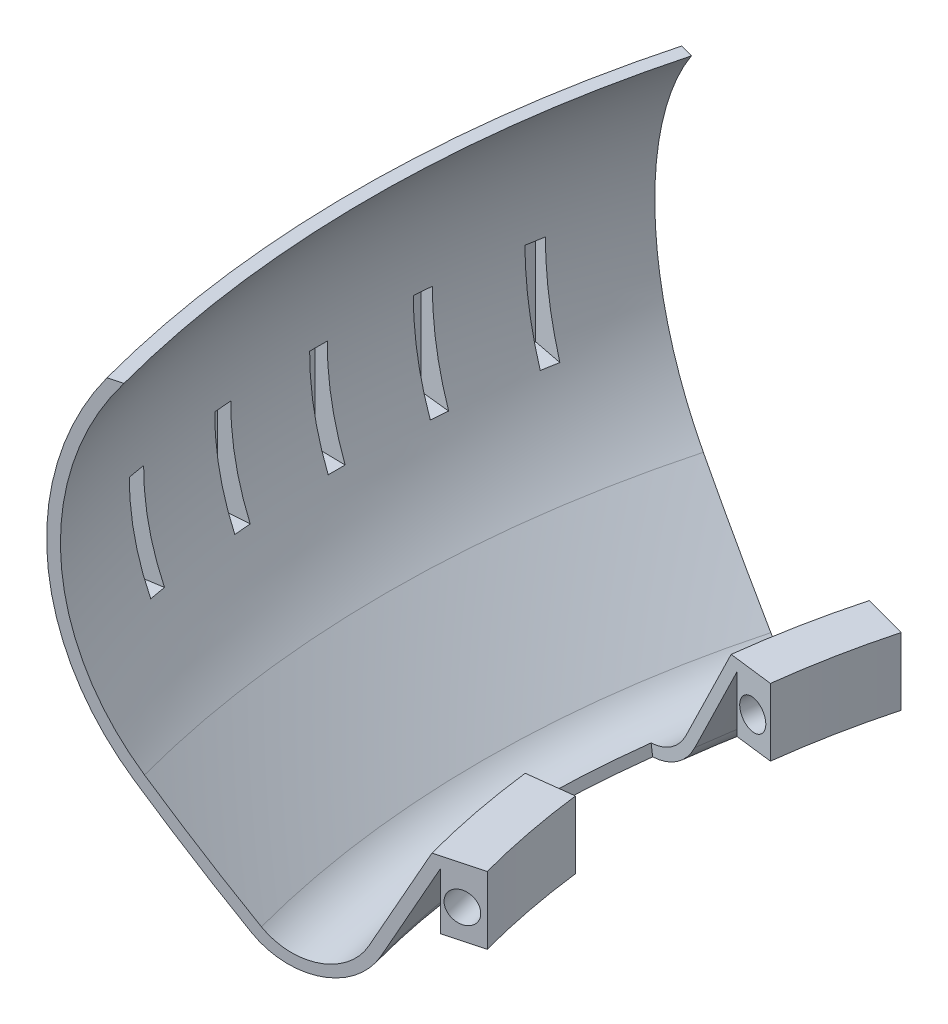
from build123d import *

# Parameters (mm, degrees)
REVOLVE1_ANGLE                  = 15
REVOLVE1_OTHER_WAY_ANGLE        = 15
REVOLVE2_START                  = 16.222144695
REVOLVE2_DEPTH                  = 16.090427574
CIRPATTERN1_COUNT               = 3
CIRPATTERN1_ANGLE               = 10
CIRPATTERN1_THE_OTHER_WAY_COUNT = 3
CIRPATTERN1_THE_OTHER_WAY_ANGLE = 10
SHELL3_START                    = 8.985762726
SHELL3_2_DEPTH                  = 42.380509533
SHELL3_START_2                  = 17.722144695
SHELL3_3_DEPTH                  = 13.090427574
SKETCH3_W                       = 5.112055803
SKETCH3_H                       = 7.485762726
REVOLVE3_ANGLE                  = 15
REVOLVE3_OTHER_WAY_ANGLE        = 15
CUT_REVOLVE2_ANGLE              = 7
CUT_REVOLVE2_OTHER_WAY_ANGLE    = 7
SKETCH11_R                      = 2


with BuildPart() as part:
    # Sketch1 → Revolve1 (revolve)
    with BuildSketch(Plane.XY):
        with BuildLine():
            Line((-111.783895357, 7.485762726), (-118.250728673, -4.885300025))
            ThreePointArc((-118.250728673, -4.885300025), (-124.705004152, -9.547595462), (-132.307869355, -7.183042355))
            ThreePointArc((-132.307869355, -7.183042355), (-138.813052314, -0.732302942), (-145.106903203, 5.924789912))
            ThreePointArc((-145.106903203, 5.924789912), (-154.580954265, 28.121202409), (-148.092110072, 51.366272259))
            Line((-148.092110072, 51.366272259), (-106.671839554, 51.366272259))
            Line((-106.671839554, 51.366272259), (-106.671839554, 7.485762726))
            Line((-106.671839554, 7.485762726), (-111.783895357, 7.485762726))
        make_face()
    revolve(axis=Axis((0, 75.962527062, 0), (0, -1, 0)), revolution_arc=REVOLVE1_ANGLE)

    # Sketch1 → Revolve1 other way (revolve)
    with BuildSketch(Plane.XY):
        with BuildLine():
            Line((-111.783895357, 7.485762726), (-118.250728673, -4.885300025))
            ThreePointArc((-118.250728673, -4.885300025), (-124.705004152, -9.547595462), (-132.307869355, -7.183042355))
            ThreePointArc((-132.307869355, -7.183042355), (-138.813052314, -0.732302942), (-145.106903203, 5.924789912))
            ThreePointArc((-145.106903203, 5.924789912), (-154.580954265, 28.121202409), (-148.092110072, 51.366272259))
            Line((-148.092110072, 51.366272259), (-106.671839554, 51.366272259))
            Line((-106.671839554, 51.366272259), (-106.671839554, 7.485762726))
            Line((-106.671839554, 7.485762726), (-111.783895357, 7.485762726))
        make_face()
    revolve(axis=Axis((0, 75.962527062, 0), (0, 1, 0)), revolution_arc=REVOLVE1_OTHER_WAY_ANGLE)

    # Revolve2: read off the stored shape, not the designer's step
    # Revolve2 outline → Revolve2 (add)
    with BuildSketch(Plane(origin=(0, 0, 0), x_dir=(1, 0, 0), z_dir=(0, 1, 0)).offset(REVOLVE2_START)):
        with BuildLine():
            ThreePointArc((-156.32174005, 2.728606122), (-156.345552235, 0), (-156.32174005, -2.728606122))
            Line((-156.32174005, -2.728606122), (-151.716418742, -2.64821994))
            Line((-151.716418742, -2.64821994), (-150, -2.61825974))
            Line((-150, -2.61825974), (-150, 2.61825974))
            Line((-150, 2.61825974), (-151.716418742, 2.64821994))
            Line((-151.716418742, 2.64821994), (-156.32174005, 2.728606122))
        make_face()
    revolve2 = extrude(amount=REVOLVE2_DEPTH)

    # CirPattern1: Revolve2 ×3 about axis
    cirpattern1_axis = Axis((0, 0, 0), (0, 1, 0))
    for i in range(1, CIRPATTERN1_COUNT):
        add(revolve2.rotate(cirpattern1_axis, i * CIRPATTERN1_ANGLE / (CIRPATTERN1_COUNT - 1)))

    # CirPattern1 the other way: Revolve2 ×3 about axis
    cirpattern1_the_other_way_axis = Axis((0, 0, 0), (0, -1, 0))
    for i in range(1, CIRPATTERN1_THE_OTHER_WAY_COUNT):
        add(revolve2.rotate(cirpattern1_the_other_way_axis, i * CIRPATTERN1_THE_OTHER_WAY_ANGLE / (CIRPATTERN1_THE_OTHER_WAY_COUNT - 1)))

    # Shell3: read off the stored shape, not the designer's step
    # Shell3 outline → Shell3 (revolve, cut)
    with BuildSketch(Plane.XY):
        with BuildLine():
            ThreePointArc((131.268982929, -6.101046516), (137.739825777, 0.315640187), (144.000452154, 6.937591016))
            ThreePointArc((144.000452154, 6.937591016), (153.114903986, 28.748570347), (146.242378119, 51.366272259))
            Line((146.242378119, 51.366272259), (112.692366824, 51.366272259))
            Line((112.692366824, 51.366272259), (112.692366824, 8.985762726))
            Line((112.692366824, 8.985762726), (119.5800606, -4.190406776))
            ThreePointArc((119.5800606, -4.190406776), (124.946978842, -8.067241366), (131.268982929, -6.101046516))
        make_face()
    revolve(axis=Axis((0, 0, 0), (0, 1, 0)), mode=Mode.SUBTRACT)

    # Shell3 2 outline → Shell3 2 (cut)
    with BuildSketch(Plane(origin=(0, 0, 0), x_dir=(1, 0, 0), z_dir=(0, 1, 0)).offset(SHELL3_START)):
        with BuildLine():
            Line((-103.037084763, 27.608703653), (-108.852467541, 29.166930772))
            ThreePointArc((-108.852467541, 29.166930772), (-112.692366824, 0), (-108.852467541, -29.166930772))
            Line((-108.852467541, -29.166930772), (-103.037084763, -27.608703653))
            ThreePointArc((-103.037084763, -27.608703653), (-106.671839554, 0), (-103.037084763, 27.608703653))
        make_face()
    extrude(amount=SHELL3_2_DEPTH, mode=Mode.SUBTRACT)

    # Shell3 3 outline → Shell3 3 (cut)
    with BuildSketch(Plane(origin=(0, 0, 0), x_dir=(1, 0, 0), z_dir=(0, 1, 0)).offset(SHELL3_START_2)):
        with BuildLine():
            ThreePointArc((-154.840882749, 1.20252917), (-154.845552235, 0), (-154.840882749, -1.20252917))
            Line((-154.840882749, -1.20252917), (-150.729272176, -1.13076074))
            Line((-150.729272176, -1.13076074), (-112.691399989, -0.466807206))
            ThreePointArc((-112.691399989, -0.466807206), (-112.692366824, 0), (-112.691399989, 0.466807206))
            Line((-112.691399989, 0.466807206), (-150.729272176, 1.13076074))
            Line((-150.729272176, 1.13076074), (-154.840882749, 1.20252917))
        make_face()
        with BuildLine():
            ThreePointArc((-112.22189026, -10.286733541), (-112.263538345, -9.821786937), (-112.303260118, -9.356671802))
            Line((-112.303260118, -9.356671802), (-150.254254081, -12.010463816))
            Line((-150.254254081, -12.010463816), (-154.356473766, -12.29731896))
            ThreePointArc((-154.356473766, -12.29731896), (-154.25631816, -13.495679116), (-154.14685912, -14.693225327))
            Line((-154.14685912, -14.693225327), (-150.057149497, -14.263379525))
            Line((-150.057149497, -14.263379525), (-112.22189026, -10.286733541))
        make_face()
        with BuildLine():
            Line((-150.254254081, 12.010463816), (-112.303260118, 9.356671802))
            ThreePointArc((-112.303260118, 9.356671802), (-112.263538345, 9.821786937), (-112.22189026, 10.286733541))
            Line((-112.22189026, 10.286733541), (-150.057149497, 14.263379525))
            Line((-150.057149497, 14.263379525), (-154.14685912, 14.693225327))
            ThreePointArc((-154.14685912, 14.693225327), (-154.25631816, 13.495679116), (-154.356473766, 12.29731896))
            Line((-154.356473766, 12.29731896), (-150.254254081, 12.010463816))
        make_face()
        with BuildLine():
            ThreePointArc((-110.898304185, -20.028371609), (-110.980316554, -19.568824134), (-111.060424629, -19.108940881))
            Line((-111.060424629, -19.108940881), (-148.635710387, -25.06028149))
            Line((-148.635710387, -25.06028149), (-152.697318814, -25.703577068))
            ThreePointArc((-152.697318814, -25.703577068), (-152.493100361, -26.888647965), (-152.279684816, -28.072097167))
            Line((-152.279684816, -28.072097167), (-110.898304185, -20.028371609))
        make_face()
        with BuildLine():
            Line((-148.635710387, 25.06028149), (-111.060424629, 19.108940881))
            ThreePointArc((-111.060424629, 19.108940881), (-110.980316554, 19.568824134), (-110.898304185, 20.028371609))
            Line((-110.898304185, 20.028371609), (-152.279684816, 28.072097167))
            ThreePointArc((-152.279684816, 28.072097167), (-152.493100361, 26.888647965), (-152.697318814, 25.703577068))
            Line((-152.697318814, 25.703577068), (-148.635710387, 25.06028149))
        make_face()
    extrude(amount=SHELL3_3_DEPTH, mode=Mode.SUBTRACT)

    # Sketch3 → Revolve3 (revolve)
    with BuildSketch(Plane.XY):
        with Locations((-109.227867456, 3.742881363)):
            Rectangle(SKETCH3_W, SKETCH3_H)
    revolve(axis=Axis((0, 7.485762726, 0), (0, 1, 0)), revolution_arc=REVOLVE3_ANGLE)

    # Sketch3 → Revolve3 other way (revolve)
    with BuildSketch(Plane.XY):
        with Locations((-109.227867456, 3.742881363)):
            Rectangle(SKETCH3_W, SKETCH3_H)
    revolve(axis=Axis((0, 7.485762726, 0), (0, -1, 0)), revolution_arc=REVOLVE3_OTHER_WAY_ANGLE)

    # Sketch8 → Cut-Revolve2 (revolve, cut)
    with BuildSketch(Plane.XY):
        with BuildLine():
            Line((-124.705004152, -9.547595462), (-130.523628013, 26.049613644))
            Line((-130.523628013, 26.049613644), (-106.671839554, 29.948362701))
            Line((-106.671839554, 29.948362701), (-106.671839554, 7.485762726))
            Line((-106.671839554, 7.485762726), (-106.671839554, 0))
            Line((-106.671839554, 0), (-111.783895357, 0))
            Line((-111.783895357, 0), (-111.783895357, 7.485762726))
            Line((-111.783895357, 7.485762726), (-118.250728673, -4.885300025))
            ThreePointArc((-118.250728673, -4.885300025), (-120.927677668, -7.978104694), (-124.705004152, -9.547595462))
        make_face()
    revolve(axis=Axis((0, 7.485762726, 0), (0, 1, 0)), revolution_arc=CUT_REVOLVE2_ANGLE, mode=Mode.SUBTRACT)

    # Sketch8 → Cut-Revolve2 other way (revolve, cut)
    with BuildSketch(Plane.XY):
        with BuildLine():
            Line((-124.705004152, -9.547595462), (-130.523628013, 26.049613644))
            Line((-130.523628013, 26.049613644), (-106.671839554, 29.948362701))
            Line((-106.671839554, 29.948362701), (-106.671839554, 7.485762726))
            Line((-106.671839554, 7.485762726), (-106.671839554, 0))
            Line((-106.671839554, 0), (-111.783895357, 0))
            Line((-111.783895357, 0), (-111.783895357, 7.485762726))
            Line((-111.783895357, 7.485762726), (-118.250728673, -4.885300025))
            ThreePointArc((-118.250728673, -4.885300025), (-120.927677668, -7.978104694), (-124.705004152, -9.547595462))
        make_face()
    revolve(axis=Axis((0, 7.485762726, 0), (0, -1, 0)), revolution_arc=CUT_REVOLVE2_OTHER_WAY_ANGLE, mode=Mode.SUBTRACT)

    # Sketch11 → Cut-Revolve3 (revolve, cut)
    with BuildSketch(Plane(origin=(0, 0, 0), x_dir=(0.9659258262890682, 0, -0.25881904510252135), z_dir=(0.2588190451025213, 0, 0.9659258262890681)), mode=Mode.PRIVATE) as cut_revolve3_sk:
        with Locations((-109.377957305, 3.882584066)):
            Circle(SKETCH11_R)
    revolve(cut_revolve3_sk.sketch.rotate(Axis((0, 7.485762726, 0), (0, 1, 0)), 334), axis=Axis((0, 7.485762726, 0), (0, 1, 0)), mode=Mode.SUBTRACT)


solid = part.part
